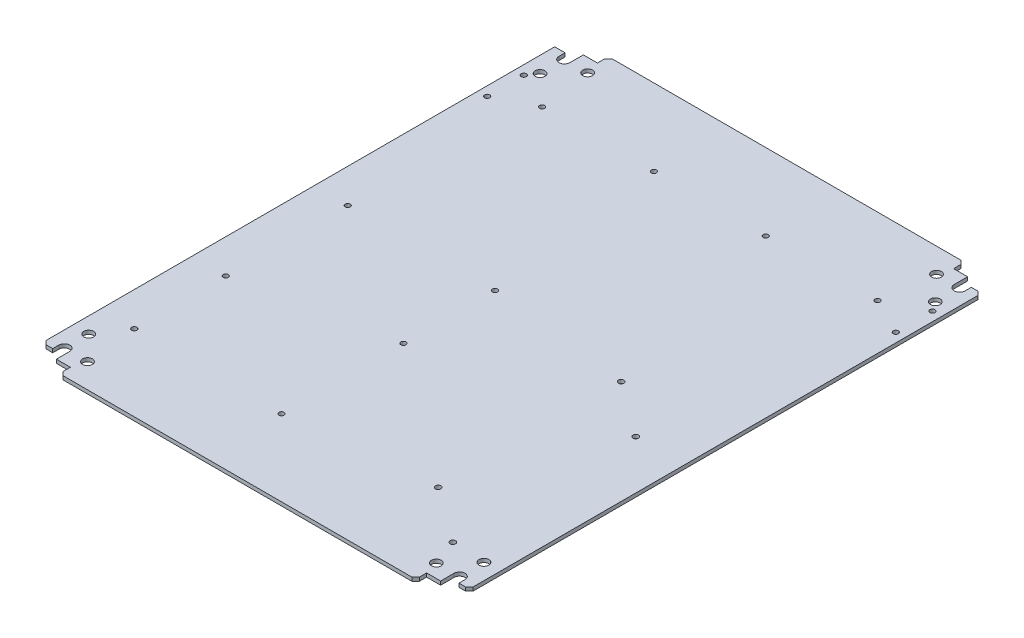
from build123d import *

# Parameters (mm, degrees)
SKETCH2_W                   = 350
SKETCH2_H                   = 450
BOSS_EXTRUDE1_DEPTH         = 3
CUT_EXTRUDE1_DEPTH          = 3
CHAMFER1_SIZE               = 3
SKETCH4_R                   = 4
CUT_EXTRUDE2_DEPTH          = 3
MIRROR1_OUTLINE_R           = 4
MIRROR1_DEPTH               = 3
MIRROR3_OUTLINE_R           = 4
MIRROR3_DEPTH               = 3
TAP_DRILL_FOR_M5X0_8_TAP1_D = 4.2
M4_CLEARANCE_HOLE1_D        = 4.5


# Read off the part's stored shape, not the designer's step: Mirror1, Mirror3
with BuildPart() as part:
    # Sketch2 → Boss-Extrude1 (new body)
    with BuildSketch(Plane(origin=(0, 0, 0), x_dir=(1, 0, 0), z_dir=(0, 1, 0))):
        Rectangle(SKETCH2_W, SKETCH2_H)
    extrude(amount=BOSS_EXTRUDE1_DEPTH)

    # Sketch3 → Cut-Extrude1 (cut)
    with BuildSketch(Plane(origin=(0, 3, 0), x_dir=(1, 0, 0), z_dir=(0, 1, 0))):
        with BuildLine():
            Line((146, 225), (146, 216))
            Line((146, 216), (157.5, 216))
            Line((157.5, 216), (157.5, 205))
            ThreePointArc((157.5, 205), (162, 200.5), (166.5, 205))
            Line((166.5, 205), (166.5, 210))
            Line((166.5, 210), (175, 210))
            Line((175, 210), (175, 225))
            Line((175, 225), (146, 225))
        make_face()
    extrude(amount=-CUT_EXTRUDE1_DEPTH, mode=Mode.SUBTRACT)

    # Chamfer1
    chamfer1_edges = [part.edges().sort_by_distance(p)[0] for p in [
        (146, 1.5, -225),
        (175, 1.5, -210),
    ]]
    chamfer(chamfer1_edges, length=CHAMFER1_SIZE)

    # Sketch4 → Cut-Extrude2 (cut)
    with BuildSketch(Plane(origin=(0, 3, 0), x_dir=(1, 0, 0), z_dir=(0, 1, 0))):
        with Locations(Location((143, 205, 0), (0, 0, 270))):
            Circle(SKETCH4_R)
        with Locations(Location((162, 185, 0), (0, 0, 270))):
            Circle(SKETCH4_R)
    extrude(amount=-CUT_EXTRUDE2_DEPTH, mode=Mode.SUBTRACT)

    # Mirror1 outline → Mirror1 (cut)
    with BuildSketch(Plane(origin=(0, 0, 0), x_dir=(1, 0, 0), z_dir=(0, 1, 0))):
        with BuildLine():
            Line((-175, 210), (-166.5, 210))
            Line((-166.5, 210), (-166.5, 205))
            ThreePointArc((-166.5, 205), (-162, 200.5), (-157.5, 205))
            Line((-157.5, 205), (-157.5, 216))
            Line((-157.5, 216), (-146, 216))
            Line((-146, 216), (-146, 222))
            Line((-146, 222), (-143, 225))
            Line((-143, 225), (-175, 225))
            Line((-175, 225), (-175, 210))
        make_face()
        with Locations((-162, 185)):
            Circle(MIRROR1_OUTLINE_R)
        with Locations((-143, 205)):
            Circle(MIRROR1_OUTLINE_R)
    extrude(amount=MIRROR1_DEPTH, mode=Mode.SUBTRACT)

    # Mirror3 outline → Mirror3 (cut)
    with BuildSketch(Plane(origin=(0, 0, 0), x_dir=(1, 0, 0), z_dir=(0, 1, 0))):
        with BuildLine():
            Line((172, -210), (166.5, -210))
            Line((166.5, -210), (166.5, -205))
            ThreePointArc((166.5, -205), (162, -200.5), (157.5, -205))
            Line((157.5, -205), (157.5, -216))
            Line((157.5, -216), (146, -216))
            Line((146, -216), (146, -222))
            Line((146, -222), (143, -225))
            Line((143, -225), (175, -225))
            Line((175, -225), (175, -207))
            Line((175, -207), (172, -210))
        make_face()
        with BuildLine():
            Line((-175, -225), (-143, -225))
            Line((-143, -225), (-146, -222))
            Line((-146, -222), (-146, -216))
            Line((-146, -216), (-157.5, -216))
            Line((-157.5, -216), (-157.5, -205))
            ThreePointArc((-157.5, -205), (-162, -200.5), (-166.5, -205))
            Line((-166.5, -205), (-166.5, -210))
            Line((-166.5, -210), (-172, -210))
            Line((-172, -210), (-175, -207))
            Line((-175, -207), (-175, -225))
        make_face()
        with Locations((-143, -205)):
            Circle(MIRROR3_OUTLINE_R)
        with Locations((143, -205)):
            Circle(MIRROR3_OUTLINE_R)
        with Locations((-162, -185)):
            Circle(MIRROR3_OUTLINE_R)
        with Locations((162, -185)):
            Circle(MIRROR3_OUTLINE_R)
    extrude(amount=MIRROR3_DEPTH, mode=Mode.SUBTRACT)

    # Tap Drill for M5x0.8 Tap1 (through all)
    with Locations(Plane(origin=(0, 3, 0), x_dir=(1, 0, 0), z_dir=(0, 1, 0))):
        with Locations((-147.15, 12.5), (-26.45, 12.5), (-26.45, -162.5), (-147.15, -162.5), (-137.5, 162.15), (-167.5, 177.15), (-167.5, 147.15), (137.5, 162.15), (167.5, 177.15), (167.5, 147.15), (-147.15, -87.5), (-26.45, -62.5), (-45.833333333, 162.15), (45.833333333, 162.15)):
            Hole(TAP_DRILL_FOR_M5X0_8_TAP1_D / 2)

    # M4 Clearance Hole1 (through all)
    with Locations(Plane(origin=(0, 3, 0), x_dir=(1, 0, 0), z_dir=(0, 1, 0))):
        with Locations((90, -0.5), (135, -33.5), (135, -183.5), (90, -150.5)):
            Hole(M4_CLEARANCE_HOLE1_D / 2)


solid = part.part
